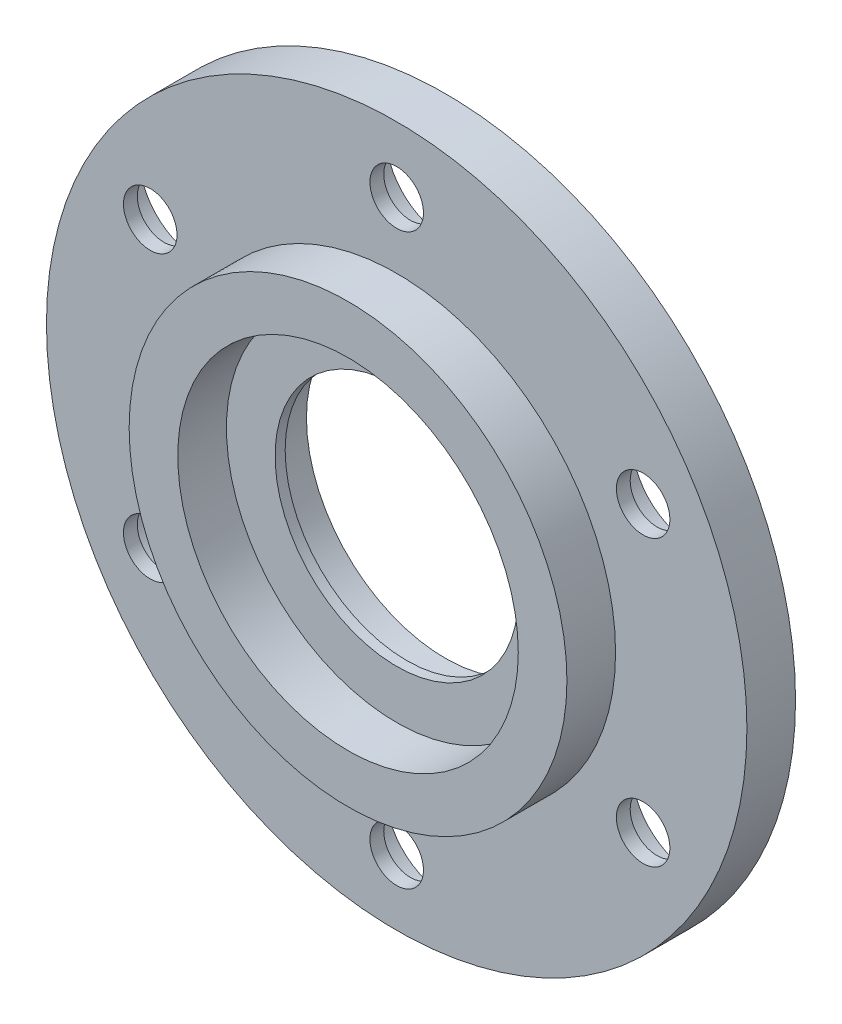
from build123d import *

# Parameters (mm, degrees)
SKETCH_CENTER_CUT_R                     = 12.5
CUT_CENTER_DEPTH                        = 52.15662225
CBORE_FOR_M5_HEX_HEAD_BOLT1_D           = 5.5
CBORE_FOR_M5_HEX_HEAD_BOLT1_CBORE_D     = 12.24
CBORE_FOR_M5_HEX_HEAD_BOLT1_CBORE_DEPTH = 3.58
CIRPATTERN1_COUNT                       = 6
SKETCH1_R                               = 14.2748
CUT_EXTRUDE1_DEPTH                      = 3.9624


with BuildPart() as part:
    # Sketch Spindle Skeleton → Main Revolve (revolve)
    with BuildSketch(Plane(origin=(0, 0, 0), x_dir=(0, 0, -1), z_dir=(1, 0, 0))):
        Polygon((-24.2, 17.5), (-24.2, 9.5), (-19.2, 9.5), (-19.2, 36), (-24.2, 36), (-24.2, 22.5), (-29.2, 22.5), (-29.2, 17.5), align=None)
    revolve(axis=Axis((0, 0, 1000), (0, 0, -1)))

    # Sketch Center Cut → Cut Center (cut, through all)
    with BuildSketch(Plane.XY.offset(24.2)):
        Circle(SKETCH_CENTER_CUT_R)
    extrude(amount=-CUT_CENTER_DEPTH, mode=Mode.SUBTRACT)

    # CBORE for M5 Hex Head Bolt1 (through all)
    with Locations(Plane(origin=(0, 0, 19.2), x_dir=(-1, 0, 0), z_dir=(0, 0, -1))):
        with Locations((0, 29.25)):
            cbore_for_m5_hex_head_bolt1 = CounterBoreHole(CBORE_FOR_M5_HEX_HEAD_BOLT1_D / 2, CBORE_FOR_M5_HEX_HEAD_BOLT1_CBORE_D / 2, CBORE_FOR_M5_HEX_HEAD_BOLT1_CBORE_DEPTH)

    # CirPattern1: CBORE for M5 Hex Head Bolt1 ×6 about axis
    cirpattern1_axis = Axis((0, 0, 19.2), (0, 0, 1))
    for i in range(1, CIRPATTERN1_COUNT):
        add(cbore_for_m5_hex_head_bolt1.rotate(cirpattern1_axis, i * 360 / CIRPATTERN1_COUNT), mode=Mode.SUBTRACT)

    # Sketch1 → Cut-Extrude1 (cut)
    with BuildSketch(Plane(origin=(0, 0, 19.2), x_dir=(-1, 0, 0), z_dir=(0, 0, -1))):
        Circle(SKETCH1_R)
    extrude(amount=-CUT_EXTRUDE1_DEPTH, mode=Mode.SUBTRACT)


solid = part.part
